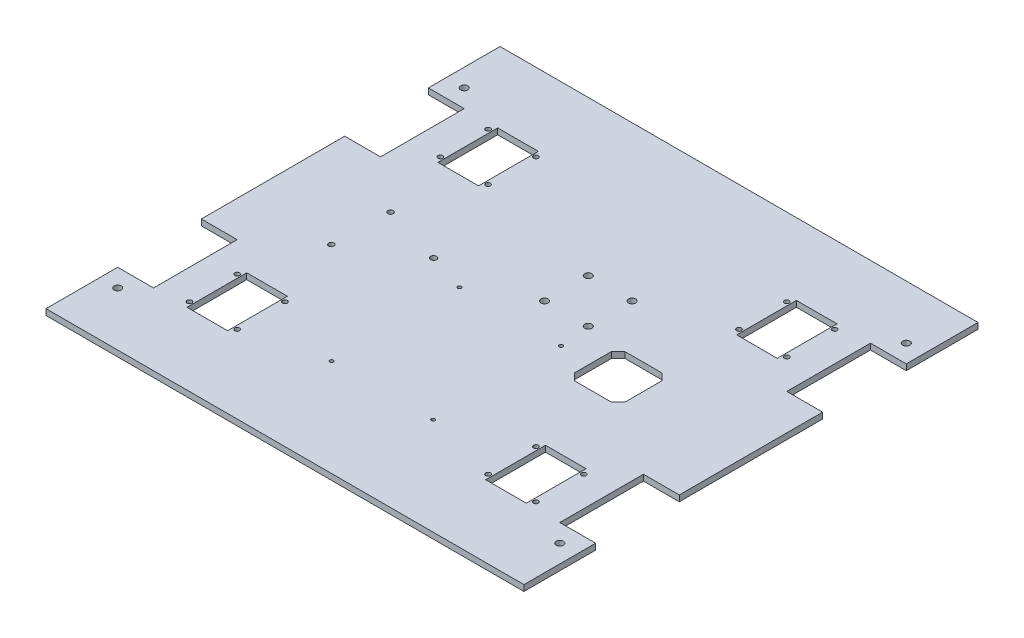
from build123d import *

# Parameters (mm, degrees)
SKETCH_1_W          = 400
SKETCH_1_H          = 380
EXTRUDE_1_DEPTH     = 5
SKETCH_2_R          = 2.25
SKETCH_2_R_2        = 2.5
SKETCH_2_R_3        = 3
SKETCH_2_R_4        = 2
SKETCH_2_R_5        = 1.5
SKETCH_2_W          = 30
SKETCH_2_H          = 70
SKETCH_2_W_2        = 34
SKETCH_2_H_2        = 50
CUT_EXTRUDE_1_DEPTH = 276.907593226


with BuildPart() as part:
    # 草圖1 → 填料-伸長1 (new body)
    with BuildSketch(Plane(origin=(0, 0, 0), x_dir=(1, 0, 0), z_dir=(0, 1, 0))):
        Rectangle(SKETCH_1_W, SKETCH_1_H)
    extrude(amount=EXTRUDE_1_DEPTH)

    # 草圖2 → 除料-伸長1 (cut, through all)
    with BuildSketch(Plane(origin=(0, 5, 0), x_dir=(1, 0, 0), z_dir=(0, 1, 0))):
        with Locations((-127.07, -24.13)):
            Circle(SKETCH_2_R)
        with Locations((-125.8, 24.13)):
            Circle(SKETCH_2_R)
        with Locations((-74.5, 8.89)):
            Circle(SKETCH_2_R_2)
        with Locations((-185, 145)):
            Circle(SKETCH_2_R_3)
        with Locations((185, 145)):
            Circle(SKETCH_2_R_3)
        with Locations((-185, -145)):
            Circle(SKETCH_2_R_3)
        with Locations((185, -145)):
            Circle(SKETCH_2_R_3)
        with Locations((3, 60.85)):
            Circle(SKETCH_2_R_3)
        with Locations((39.7, 60.85)):
            Circle(SKETCH_2_R_3)
        with Locations((3, 24.15)):
            Circle(SKETCH_2_R_3)
        with Locations((39.7, 24.15)):
            Circle(SKETCH_2_R_3)
        with Locations((-145, -85)):
            Circle(SKETCH_2_R_4)
        with Locations((-105, -85)):
            Circle(SKETCH_2_R_4)
        with Locations((-145, -125)):
            Circle(SKETCH_2_R_4)
        with Locations((-105, -125)):
            Circle(SKETCH_2_R_4)
        with Locations((105, -85)):
            Circle(SKETCH_2_R_4)
        with Locations((145, -85)):
            Circle(SKETCH_2_R_4)
        with Locations((105, -125)):
            Circle(SKETCH_2_R_4)
        with Locations((145, -125)):
            Circle(SKETCH_2_R_4)
        with Locations((-145, 125)):
            Circle(SKETCH_2_R_4)
        with Locations((-105, 125)):
            Circle(SKETCH_2_R_4)
        with Locations((-145, 85)):
            Circle(SKETCH_2_R_4)
        with Locations((-105, 85)):
            Circle(SKETCH_2_R_4)
        with Locations((105, 125)):
            Circle(SKETCH_2_R_4)
        with Locations((145, 125)):
            Circle(SKETCH_2_R_4)
        with Locations((105, 85)):
            Circle(SKETCH_2_R_4)
        with Locations((145, 85)):
            Circle(SKETCH_2_R_4)
        with Locations((-42.5, -1.5)):
            Circle(SKETCH_2_R_5)
        with Locations((42.5, -1.5)):
            Circle(SKETCH_2_R_5)
        with Locations((-42.5, -108.5)):
            Circle(SKETCH_2_R_5)
        with Locations((42.5, -108.5)):
            Circle(SKETCH_2_R_5)
        with Locations((185, -95)):
            Rectangle(SKETCH_2_W, SKETCH_2_H)
        with Locations((-185, 95)):
            Rectangle(SKETCH_2_W, SKETCH_2_H)
        with Locations((-185, -95)):
            Rectangle(SKETCH_2_W, SKETCH_2_H)
        with Locations((185, 95)):
            Rectangle(SKETCH_2_W, SKETCH_2_H)
        with Locations((-125, -105)):
            Rectangle(SKETCH_2_W_2, SKETCH_2_H_2)
        with Locations((125, -105)):
            Rectangle(SKETCH_2_W_2, SKETCH_2_H_2)
        with Locations((-125, 105)):
            Rectangle(SKETCH_2_W_2, SKETCH_2_H_2)
        with Locations((125, 105)):
            Rectangle(SKETCH_2_W_2, SKETCH_2_H_2)
        Polygon((67.7, 15.5), (73.35, 21.15), (104.35, 21.15), (110, 15.5), (110, -15.5), (104.35, -21.15), (73.35, -21.15), (67.7, -15.5), align=None)
    extrude(amount=-CUT_EXTRUDE_1_DEPTH, mode=Mode.SUBTRACT)


solid = part.part
